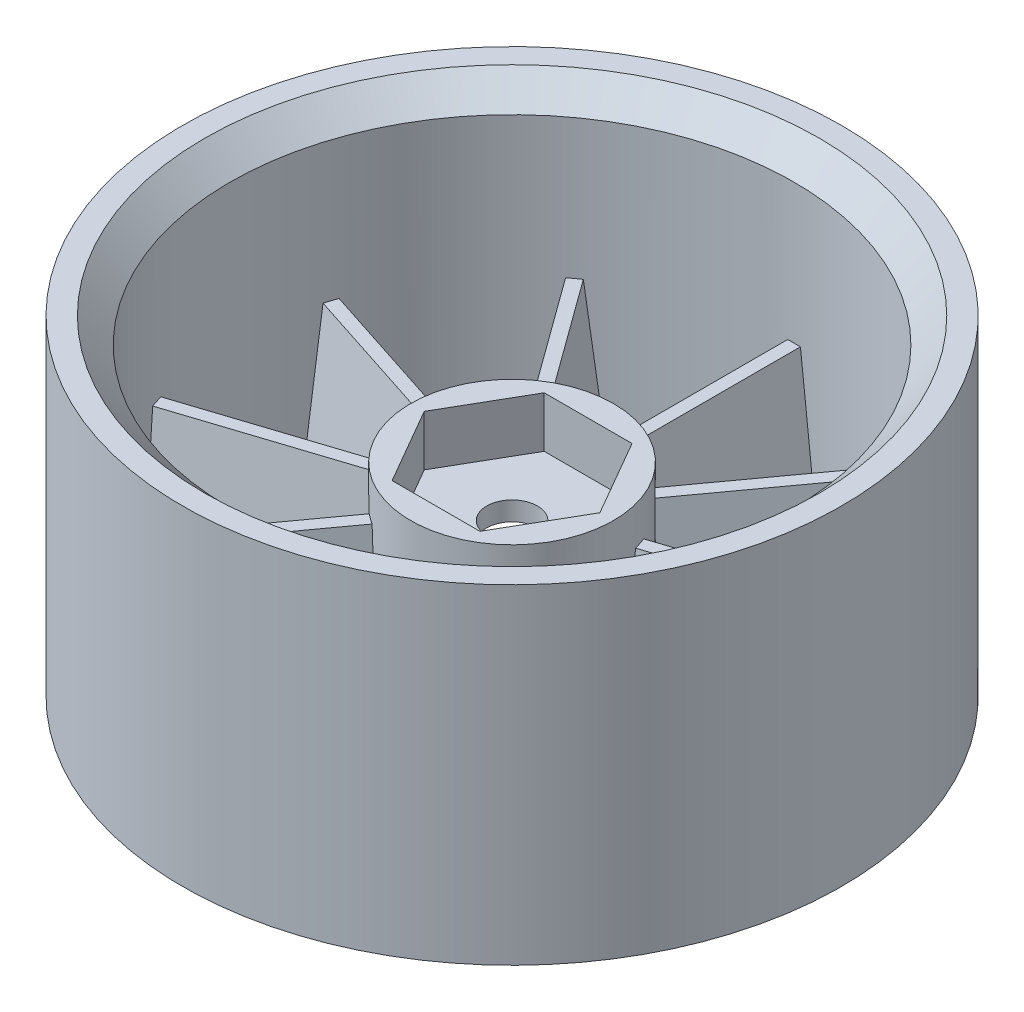
from build123d import *

# Parameters (mm, degrees)
SKETCH_1_R                       = 26
EXTRUDE_1_DEPTH                  = 26
SKETCH_2_R                       = 22.5
CUT_EXTRUDE_1_DEPTH              = 46.033320997
SKETCH_3_R                       = 8
EXTRUDE_2_DEPTH                  = 6
CUT_EXTRUDE_2_DEPTH              = 4
EXTRUDE_3_DEPTH                  = 2
CUT_EXTRUDE_3_DEPTH              = 14.91
FILLET_1_R                       = 10
PATTERN_CIRCULAR_1_COUNT         = 10
PATTERN_CIRCULAR_1_2_COUNT       = 10
FILLET_1_OF_PATTERN_CIRCULAR_1_R = 10
EXTRUDE_START                    = -26
SKETCH_8_R                       = 22.5
SKETCH_8_R_2                     = 22.25
EXTRUDE_5_DEPTH                  = 26
CHAMFER_2_SIZE                   = 2
SKETCH_9_R                       = 6
CUT_EXTRUDE_4_DEPTH              = 0.5
SKETCH_10_R                      = 2
CUT_EXTRUDE_5_DEPTH              = 40.903007536
CHAMFER_3_SIZE                   = 1


with BuildPart() as part:
    # 草图1 → 凸台-拉伸1 (new body)
    with BuildSketch(Plane(origin=(0, 0, 0), x_dir=(1, 0, 0), z_dir=(0, 1, 0))):
        with Locations(Location((0, 0, 0), (0, 0, 90))):
            Circle(SKETCH_1_R)
    extrude(amount=EXTRUDE_1_DEPTH)

    # 草图2 → 切除-拉伸1 (cut, through all)
    with BuildSketch(Plane(origin=(0, 26, 0), x_dir=(1, 0, 0), z_dir=(0, 1, 0))):
        with Locations(Location((0, 0, 0), (0, 0, 270))):
            Circle(SKETCH_2_R)
    extrude(amount=-CUT_EXTRUDE_1_DEPTH, mode=Mode.SUBTRACT)

    # 草图5 → 凸台-拉伸3 (add, symmetric)
    with BuildSketch(Plane(origin=(0, 0, 0), x_dir=(0, 0, -1), z_dir=(1, 0, 0))):
        with BuildLine():
            Line((22.5, 0), (17.5, 0))
            add(Edge.make_bspline(
                [(17.5, 0), (11.370815386, 3.892771804), (7.5, 10)],
                knots=[0, 0, 0, 1, 1, 1], degree=2))
            Line((7.5, 10), (7.5, 13))
            Line((7.5, 13), (22.5, 13))
            Line((22.5, 13), (22.5, 0))
        make_face()
    extrude_3 = extrude(amount=EXTRUDE_3_DEPTH, both=True)

    # 草图7 → 切除-拉伸3 (cut)
    with BuildSketch(Plane.XY.offset(-7.5)):
        Polygon((-2, 0), (-0.5, 13), (-2, 13), align=None)
        Polygon((2, 0), (0.501807348, 13), (2, 13), align=None)
    cut_extrude_3 = extrude(amount=-CUT_EXTRUDE_3_DEPTH, mode=Mode.SUBTRACT)

    # 圆角1
    fillet_1_edges = [part.edges().sort_by_distance(p)[0] for p in [
        (-1, 0, -17.5),
    ]]
    fillet(fillet_1_edges, radius=FILLET_1_R)

    # 阵列(圆周)1: 凸台-拉伸3 ×10 about axis
    pattern_circular_1_axis = Axis((0, 26, 0), (0, -1, 0))
    for i in range(1, PATTERN_CIRCULAR_1_COUNT):
        add(extrude_3.rotate(pattern_circular_1_axis, i * 360 / PATTERN_CIRCULAR_1_COUNT))

    # Pattern Circular 1 2: 切除-拉伸3 ×10 about axis
    pattern_circular_1_2_axis = Axis((0, 26, 0), (0, -1, 0))
    for i in range(1, PATTERN_CIRCULAR_1_2_COUNT):
        add(cut_extrude_3.rotate(pattern_circular_1_2_axis, i * 360 / PATTERN_CIRCULAR_1_2_COUNT), mode=Mode.SUBTRACT)

    # 圆角1 of 阵列(圆周)1
    fillet_1_of_pattern_circular_1_edges = [part.edges().sort_by_distance(p)[0] for p in [
        (9.477224921, 0, -14.745582654),
        (16.334472041, 0, -6.358853918),
        (16.95250603, 0, 4.456740885),
        (11.095258909, 0, 13.570012149),
        (1, 0, 17.5),
        (-9.477224921, 0, 14.745582654),
        (-16.334472041, 0, 6.358853918),
        (-16.95250603, 0, -4.456740885),
        (-11.095258909, 0, -13.570012149),
    ]]
    fillet(fillet_1_of_pattern_circular_1_edges, radius=FILLET_1_OF_PATTERN_CIRCULAR_1_R)


with BuildPart() as body_2:
    # 草图3 → 凸台-拉伸2 (new body)
    with BuildSketch(Plane(origin=(0, 10, 0), x_dir=(-1, 0, 0), z_dir=(0, -1, 0))):
        with Locations(Location((0, 0, 0), (0, 0, 90))):
            Circle(SKETCH_3_R)
    extrude(amount=-EXTRUDE_2_DEPTH)

    # 草图4 → 切除-拉伸2 (cut)
    with BuildSketch(Plane(origin=(0, 16, 0), x_dir=(1, 0, 0), z_dir=(0, 1, 0))):
        Polygon((-3.464101615, 6), (-6.92820323, 0), (-3.464101615, -6), (3.464101615, -6), (6.92820323, 0), (3.464101615, 6), align=None)
    extrude(amount=-CUT_EXTRUDE_2_DEPTH, mode=Mode.SUBTRACT)


    add(part.part)  # 凸台-拉伸5 merges part
    # 草图8 → 凸台-拉伸5 (add)
    with BuildSketch(Plane.XZ.offset(EXTRUDE_START)):
        Circle(SKETCH_8_R)
        with Locations(Location((0, 0, 0), (0, 0, 268.712346003))):
            Circle(SKETCH_8_R_2, mode=Mode.SUBTRACT)
    extrude(amount=EXTRUDE_5_DEPTH)

    # 倒角2
    chamfer_2_edges = [body_2.edges().sort_by_distance(p)[0] for p in [
        (0.5, 26, 22.244381313),
    ]]
    chamfer(chamfer_2_edges, length=CHAMFER_2_SIZE)

    # 草图9 → 切除-拉伸4 (cut)
    with BuildSketch(Plane(origin=(0, 10, 0), x_dir=(-1, 0, 0), z_dir=(0, -1, 0))):
        with Locations(Location((0, 0, 0), (0, 0, 90))):
            Circle(SKETCH_9_R)
    extrude(amount=-CUT_EXTRUDE_4_DEPTH, mode=Mode.SUBTRACT)

    # 草图10 → 切除-拉伸5 (cut, through all)
    with BuildSketch(Plane.XZ.offset(-10.5)):
        with Locations(Location((0, 0, 0), (0, 0, 270))):
            Circle(SKETCH_10_R)
    extrude(amount=-CUT_EXTRUDE_5_DEPTH, mode=Mode.SUBTRACT)

    # 倒角3
    # the kernel refuses this chamfer: 1 mm, written as the material it takes off along each edge
    with BuildSketch(Plane(origin=(0, 0, 0), x_dir=(-0.5669039290997151, 0, 0.8237839129112107), z_dir=(0.8237839129112107, 0, 0.5669039290997151))) as chamfer_3_piece_1_section:
        Polygon((22.25, -CHAMFER_3_SIZE), (22.25 + CHAMFER_3_SIZE, 0), (22.25, 0), align=None)
    chamfer_3_piece_1 = revolve(axis=Axis((0, 0, 0), (0, -1, 0)), revolution_arc=38.930783457, mode=Mode.PRIVATE)
    chamfer_3_piece_1 = split(chamfer_3_piece_1, bisect_by=Plane(origin=(-19.62479074, -0.235254641, 8.507947191), z_dir=(0.30698024354811193, 0.11462410798513052, 0.9447880418060737)), keep=Keep.TOP, mode=Mode.PRIVATE)
    chamfer_3_piece_1 = split(chamfer_3_piece_1, bisect_by=Plane(origin=(-14.155835967, -0.234592155, 16.035237562), z_dir=(-0.8036974270817374, 0.11448780889351218, -0.5839203604233697)), keep=Keep.TOP, mode=Mode.PRIVATE)
    add(chamfer_3_piece_1, mode=Mode.SUBTRACT)
    with BuildSketch(Plane(origin=(0, 0, 0), x_dir=(0.02557312226542573, 0, 0.9996729542293308), z_dir=(0.9996729542293308, 0, -0.02557312226542573))) as chamfer_3_piece_2_section:
        Polygon((22.25, -CHAMFER_3_SIZE), (22.25 + CHAMFER_3_SIZE, 0), (22.25, 0), align=None)
    chamfer_3_piece_2 = revolve(axis=Axis((0, 0, 0), (0, -1, 0)), revolution_arc=38.930783457, mode=Mode.PRIVATE)
    chamfer_3_piece_2 = split(chamfer_3_piece_2, bisect_by=Plane(origin=(-10.875943334, -0.235254641, 18.418236441), z_dir=(0.8036847114836775, 0.11462410798513054, 0.58391112200061)), keep=Keep.TOP, mode=Mode.PRIVATE)
    chamfer_3_piece_2 = split(chamfer_3_piece_2, bisect_by=Plane(origin=(-2.027035711, -0.234592155, 21.293371312), z_dir=(-0.993424653214708, 0.11448780889351219, 0)), keep=Keep.TOP, mode=Mode.PRIVATE)
    add(chamfer_3_piece_2, mode=Mode.SUBTRACT)
    with BuildSketch(Plane(origin=(0, 0, 0), x_dir=(0.6082821101236053, 0, 0.7937209046658491), z_dir=(0.7937209046658491, 0, -0.6082821101236053))) as chamfer_3_piece_3_section:
        Polygon((22.25, -CHAMFER_3_SIZE), (22.25 + CHAMFER_3_SIZE, 0), (22.25, 0), align=None)
    chamfer_3_piece_3 = revolve(axis=Axis((0, 0, 0), (0, -1, 0)), revolution_arc=38.930783457, mode=Mode.PRIVATE)
    chamfer_3_piece_3 = split(chamfer_3_piece_3, bisect_by=Plane(origin=(10.87602329, -0.234592155, 18.418160956), z_dir=(-0.8036974270817373, 0.11448780889351218, 0.5839203604233697)), keep=Keep.TOP, mode=Mode.PRIVATE)
    chamfer_3_piece_3 = split(chamfer_3_piece_3, bisect_by=Plane(origin=(2.027144766, -0.235254641, 21.293385383), z_dir=(0.9934089358711311, 0.11462410798513052, 0)), keep=Keep.TOP, mode=Mode.PRIVATE)
    add(chamfer_3_piece_3, mode=Mode.SUBTRACT)
    with BuildSketch(Plane(origin=(0, 0, 0), x_dir=(0.9586480066630826, 0, 0.2845944471013068), z_dir=(0.2845944471013068, 0, -0.9586480066630826))) as chamfer_3_piece_4_section:
        Polygon((22.25, -CHAMFER_3_SIZE), (22.25 + CHAMFER_3_SIZE, 0), (22.25, 0), align=None)
    chamfer_3_piece_4 = revolve(axis=Axis((0, 0, 0), (0, -1, 0)), revolution_arc=38.930783457, mode=Mode.PRIVATE)
    chamfer_3_piece_4 = split(chamfer_3_piece_4, bisect_by=Plane(origin=(19.624811057, -0.234592155, 8.507839125), z_dir=(-0.3069851004743835, 0.11448780889351216, 0.9448029898881011)), keep=Keep.TOP, mode=Mode.PRIVATE)
    chamfer_3_piece_4 = split(chamfer_3_piece_4, bisect_by=Plane(origin=(14.155932466, -0.235254641, 16.035184845), z_dir=(0.8036847114836774, 0.11462410798513055, -0.5839111220006101)), keep=Keep.TOP, mode=Mode.PRIVATE)
    add(chamfer_3_piece_4, mode=Mode.SUBTRACT)
    with BuildSketch(Plane(origin=(0, 0, 0), x_dir=(0.9428429479045894, 0, -0.3332374162464108), z_dir=(-0.3332374162464108, 0, -0.9428429479045894))) as chamfer_3_piece_5_section:
        Polygon((22.25, -CHAMFER_3_SIZE), (22.25 + CHAMFER_3_SIZE, 0), (22.25, 0), align=None)
    chamfer_3_piece_5 = revolve(axis=Axis((0, 0, 0), (0, -1, 0)), revolution_arc=38.930783457, mode=Mode.PRIVATE)
    chamfer_3_piece_5 = split(chamfer_3_piece_5, bisect_by=Plane(origin=(20.877588023, -0.234592155, -4.652188081), z_dir=(0.30698510047438354, 0.11448780889351215, 0.9448029898881011)), keep=Keep.TOP, mode=Mode.PRIVATE)
    chamfer_3_piece_5 = split(chamfer_3_piece_5, bisect_by=Plane(origin=(20.877635106, -0.235254641, 4.652088712), z_dir=(0.3069802435481119, 0.11462410798513054, -0.9447880418060737)), keep=Keep.TOP, mode=Mode.PRIVATE)
    add(chamfer_3_piece_5, mode=Mode.SUBTRACT)
    with BuildSketch(Plane(origin=(0, 0, 0), x_dir=(0.5669039290997152, 0, -0.8237839129112107), z_dir=(-0.8237839129112107, 0, -0.5669039290997152))) as chamfer_3_piece_6_section:
        Polygon((22.25, -CHAMFER_3_SIZE), (22.25 + CHAMFER_3_SIZE, 0), (22.25, 0), align=None)
    chamfer_3_piece_6 = revolve(axis=Axis((0, 0, 0), (0, -1, 0)), revolution_arc=38.930783457, mode=Mode.PRIVATE)
    chamfer_3_piece_6 = split(chamfer_3_piece_6, bisect_by=Plane(origin=(14.155835967, -0.234592155, -16.035237562), z_dir=(0.8036974270817373, 0.11448780889351218, 0.5839203604233697)), keep=Keep.TOP, mode=Mode.PRIVATE)
    chamfer_3_piece_6 = split(chamfer_3_piece_6, bisect_by=Plane(origin=(19.62479074, -0.235254641, -8.507947191), z_dir=(-0.30698024354811193, 0.11462410798513052, -0.9447880418060737)), keep=Keep.TOP, mode=Mode.PRIVATE)
    add(chamfer_3_piece_6, mode=Mode.SUBTRACT)
    with BuildSketch(Plane(origin=(0, 0, 0), x_dir=(-0.025573122265435483, 0, -0.9996729542293304), z_dir=(-0.9996729542293304, 0, 0.025573122265435483))) as chamfer_3_piece_7_section:
        Polygon((22.25, -CHAMFER_3_SIZE), (22.25 + CHAMFER_3_SIZE, 0), (22.25, 0), align=None)
    chamfer_3_piece_7 = revolve(axis=Axis((0, 0, 0), (0, -1, 0)), revolution_arc=38.930783457, mode=Mode.PRIVATE)
    chamfer_3_piece_7 = split(chamfer_3_piece_7, bisect_by=Plane(origin=(2.027035711, -0.234592155, -21.293371312), z_dir=(0.993424653214708, 0.11448780889351219, 0)), keep=Keep.TOP, mode=Mode.PRIVATE)
    chamfer_3_piece_7 = split(chamfer_3_piece_7, bisect_by=Plane(origin=(10.875943334, -0.235254641, -18.418236441), z_dir=(-0.8036847114836774, 0.11462410798513054, -0.58391112200061)), keep=Keep.TOP, mode=Mode.PRIVATE)
    add(chamfer_3_piece_7, mode=Mode.SUBTRACT)
    with BuildSketch(Plane(origin=(0, 0, 0), x_dir=(-0.6082821101236056, 0, -0.7937209046658491), z_dir=(-0.7937209046658491, 0, 0.6082821101236056))) as chamfer_3_piece_8_section:
        Polygon((22.25, -CHAMFER_3_SIZE), (22.25 + CHAMFER_3_SIZE, 0), (22.25, 0), align=None)
    chamfer_3_piece_8 = revolve(axis=Axis((0, 0, 0), (0, -1, 0)), revolution_arc=38.930783457, mode=Mode.PRIVATE)
    chamfer_3_piece_8 = split(chamfer_3_piece_8, bisect_by=Plane(origin=(-2.027144766, -0.235254641, -21.293385383), z_dir=(-0.9934089358711311, 0.11462410798513052, 0)), keep=Keep.TOP, mode=Mode.PRIVATE)
    chamfer_3_piece_8 = split(chamfer_3_piece_8, bisect_by=Plane(origin=(-10.87602329, -0.234592155, -18.418160956), z_dir=(0.8036974270817374, 0.1144878088935122, -0.5839203604233699)), keep=Keep.TOP, mode=Mode.PRIVATE)
    add(chamfer_3_piece_8, mode=Mode.SUBTRACT)
    with BuildSketch(Plane(origin=(0, 0, 0), x_dir=(-0.9586480066630828, 0, -0.2845944471013059), z_dir=(-0.2845944471013059, 0, 0.9586480066630828))) as chamfer_3_piece_9_section:
        Polygon((22.25, -CHAMFER_3_SIZE), (22.25 + CHAMFER_3_SIZE, 0), (22.25, 0), align=None)
    chamfer_3_piece_9 = revolve(axis=Axis((0, 0, 0), (0, -1, 0)), revolution_arc=38.930783457, mode=Mode.PRIVATE)
    chamfer_3_piece_9 = split(chamfer_3_piece_9, bisect_by=Plane(origin=(-14.155932466, -0.235254641, -16.035184845), z_dir=(-0.8036847114836773, 0.11462410798513054, 0.5839111220006102)), keep=Keep.TOP, mode=Mode.PRIVATE)
    chamfer_3_piece_9 = split(chamfer_3_piece_9, bisect_by=Plane(origin=(-19.624811057, -0.234592155, -8.507839125), z_dir=(0.3069851004743833, 0.11448780889351218, -0.9448029898881013)), keep=Keep.TOP, mode=Mode.PRIVATE)
    add(chamfer_3_piece_9, mode=Mode.SUBTRACT)
    with BuildSketch(Plane(origin=(0, 0, 0), x_dir=(-0.9428429479045893, 0, 0.3332374162464114), z_dir=(0.3332374162464114, 0, 0.9428429479045893))) as chamfer_3_piece_10_section:
        Polygon((22.25, -CHAMFER_3_SIZE), (22.25 + CHAMFER_3_SIZE, 0), (22.25, 0), align=None)
    chamfer_3_piece_10 = revolve(axis=Axis((0, 0, 0), (0, -1, 0)), revolution_arc=38.930783457, mode=Mode.PRIVATE)
    chamfer_3_piece_10 = split(chamfer_3_piece_10, bisect_by=Plane(origin=(-20.877635106, -0.235254641, -4.652088712), z_dir=(-0.30698024354811165, 0.11462410798513052, 0.9447880418060737)), keep=Keep.TOP, mode=Mode.PRIVATE)
    chamfer_3_piece_10 = split(chamfer_3_piece_10, bisect_by=Plane(origin=(-20.877588023, -0.234592155, 4.652188081), z_dir=(-0.30698510047438354, 0.11448780889351215, -0.9448029898881011)), keep=Keep.TOP, mode=Mode.PRIVATE)
    add(chamfer_3_piece_10, mode=Mode.SUBTRACT)


solid = body_2.part
